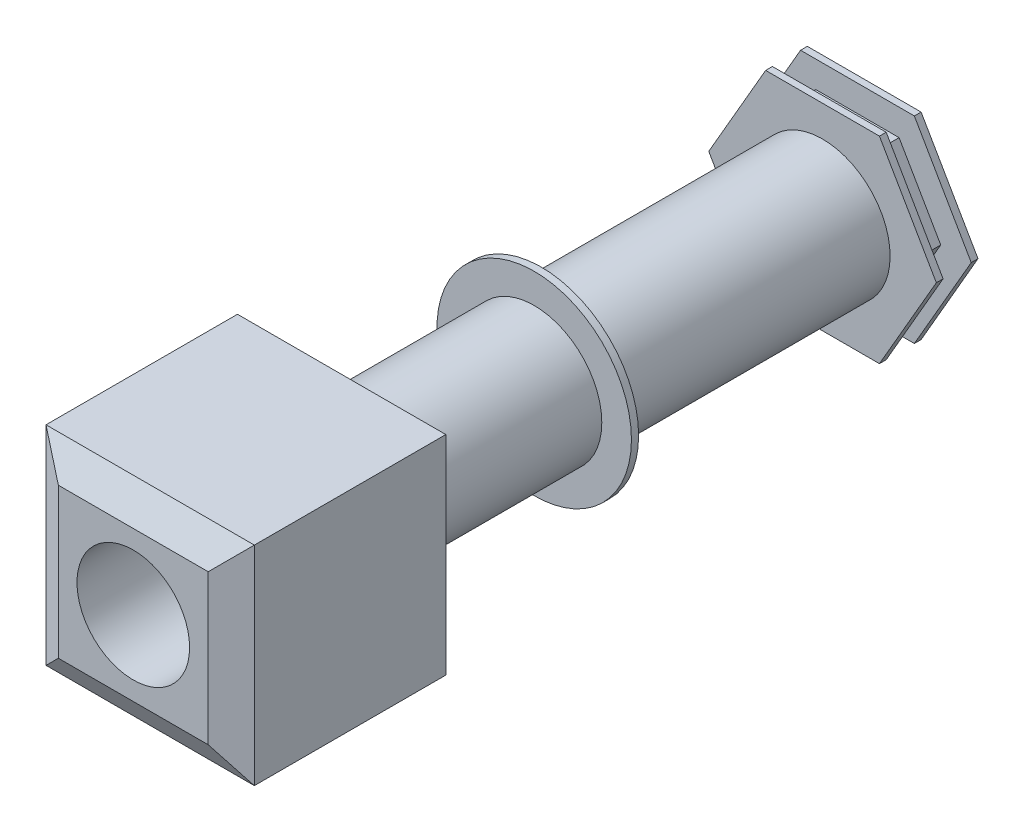
from build123d import *
from OCP.BRepFilletAPI import BRepFilletAPI_MakeChamfer

# Parameters (mm, degrees)
BOSS_EXTRUDE1_DEPTH = 12
BOSS_EXTRUDE2_DEPTH = 50
BOSS_EXTRUDE3_DEPTH = 12
SKETCH4_R           = 120
BOSS_EXTRUDE4_DEPTH = 500
SKETCH5_R           = 172.646944325
BOSS_EXTRUDE5_DEPTH = 12
CHAMFER1_SIZE       = 56.712818196
CHAMFER1_SIZE_2     = 10
SKETCH6_R           = 120
BOSS_EXTRUDE6_DEPTH = 330
SKETCH8_R           = 172.646944325
BOSS_EXTRUDE7_DEPTH = 12
CHAMFER2_SIZE       = 6
CHAMFER2_SIZE2      = 16.484864517
SKETCH9_W           = 370
SKETCH9_H           = 370
BOSS_EXTRUDE8_DEPTH = 370
SKETCH10_R          = 100
CUT_EXTRUDE1_DEPTH  = 900
CHAMFER3_SIZE       = 30
CHAMFER3_SIZE2      = 51.961524227


with BuildPart() as part:
    # Sketch1 → Boss-Extrude1 (new body)
    with BuildSketch(Plane.XY):
        Polygon((202.072594216, 0), (101.036297108, 175), (-101.036297108, 175), (-202.072594216, 0), (-101.036297108, -175), (101.036297108, -175), align=None)
    extrude(amount=BOSS_EXTRUDE1_DEPTH)

    # Sketch2 → Boss-Extrude2 (add)
    with BuildSketch(Plane.XY.offset(12)):
        Polygon((147.887498821, 0), (73.943749411, 128.074330881), (-73.943749411, 128.074330881), (-147.887498821, 0), (-73.943749411, -128.074330881), (73.943749411, -128.074330881), align=None)
    extrude(amount=BOSS_EXTRUDE2_DEPTH)

    # Sketch3 → Boss-Extrude3 (add)
    with BuildSketch(Plane.XY.offset(62)):
        Polygon((202.072594216, 0), (101.036297108, 175), (-101.036297108, 175), (-202.072594216, 0), (-101.036297108, -175), (101.036297108, -175), align=None)
    extrude(amount=BOSS_EXTRUDE3_DEPTH)

    # Sketch4 → Boss-Extrude4 (add)
    with BuildSketch(Plane.XY.offset(74)):
        Circle(SKETCH4_R)
    extrude(amount=BOSS_EXTRUDE4_DEPTH)

    # Sketch5 → Boss-Extrude5 (add)
    with BuildSketch(Plane.XY.offset(574)):
        Circle(SKETCH5_R)
    extrude(amount=BOSS_EXTRUDE5_DEPTH)

    # Chamfer1
    # the kernel refuses this chamfer: 56.712818196, 10 mm, written as the material it adds along each edge
    with BuildSketch(Plane(origin=(0, 0, 574), x_dir=(1, 0, 0), z_dir=(0, -1, 0))) as chamfer1_piece_1_section:
        Polygon((120 + CHAMFER1_SIZE, 0), (120, -CHAMFER1_SIZE_2), (120, 0), align=None)
    chamfer1_piece_1 = revolve(axis=Axis((0, 0, 574), (0, 0, 1)), mode=Mode.PRIVATE)
    chamfer1_piece_1 = chamfer1_piece_1 & Plane(origin=(0, 0, 569.114385433), x_dir=(1, 0, 0), z_dir=(0, 0, -1)) * Cylinder(172.646944325, 707, mode=Mode.PRIVATE)
    add(chamfer1_piece_1)

    # Sketch6 → Boss-Extrude6 (add)
    with BuildSketch(Plane.XY.offset(586)):
        Circle(SKETCH6_R)
    extrude(amount=BOSS_EXTRUDE6_DEPTH)

    # Sketch8 → Boss-Extrude7 (add)
    with BuildSketch(Plane.XY.offset(916)):
        Circle(SKETCH8_R)
    extrude(amount=BOSS_EXTRUDE7_DEPTH)

    # Chamfer2
    chamfer2_edges = [part.edges().sort_by_distance(p)[0] for p in [
        (-120, 0, 916),
    ]]
    chamfer2_side = [part.faces().sort_by_distance(p)[0] for p in [
        (-120, 0, 751),
    ]]
    chamfer(chamfer2_edges, length=CHAMFER2_SIZE, length2=CHAMFER2_SIZE2, reference=chamfer2_side[0])

    # Sketch9 → Boss-Extrude8 (add)
    with BuildSketch(Plane.XY.offset(928)):
        Rectangle(SKETCH9_W, SKETCH9_H)
    extrude(amount=BOSS_EXTRUDE8_DEPTH)

    # Sketch10 → Cut-Extrude1 (cut)
    with BuildSketch(Plane.XY.offset(1298)):
        Circle(SKETCH10_R)
    extrude(amount=-CUT_EXTRUDE1_DEPTH, mode=Mode.SUBTRACT)

    # Chamfer3: one chamfer whose edges measure the first distance from different faces: ONE call of the kernel's chamfer builder (chamfer() names one face for all edges)
    chamfer3_edges_1 = [part.edges().sort_by_distance(p)[0] for p in [
        (185, 0, 1298),
    ]]
    chamfer3_side_1 = [part.faces().sort_by_distance(p)[0] for p in [
        (185, 0, 1113),
    ]]
    chamfer3_edges_2 = [part.edges().sort_by_distance(p)[0] for p in [
        (0, 185, 1298),
    ]]
    chamfer3_side_2 = [part.faces().sort_by_distance(p)[0] for p in [
        (0, 185, 1113),
    ]]
    chamfer3_edges_3 = [part.edges().sort_by_distance(p)[0] for p in [
        (-185, 0, 1298),
    ]]
    chamfer3_side_3 = [part.faces().sort_by_distance(p)[0] for p in [
        (-185, 0, 1113),
    ]]
    chamfer3_edges_4 = [part.edges().sort_by_distance(p)[0] for p in [
        (0, -185, 1298),
    ]]
    chamfer3_side_4 = [part.faces().sort_by_distance(p)[0] for p in [
        (0, -185, 1113),
    ]]
    chamfer3 = BRepFilletAPI_MakeChamfer(part.part.solid().wrapped)
    for e in chamfer3_edges_1:
        chamfer3.Add(CHAMFER3_SIZE, CHAMFER3_SIZE2, e.wrapped, chamfer3_side_1[0].wrapped)  # the first distance lies on this face
    for e in chamfer3_edges_2:
        chamfer3.Add(CHAMFER3_SIZE, CHAMFER3_SIZE2, e.wrapped, chamfer3_side_2[0].wrapped)  # the first distance lies on this face
    for e in chamfer3_edges_3:
        chamfer3.Add(CHAMFER3_SIZE, CHAMFER3_SIZE2, e.wrapped, chamfer3_side_3[0].wrapped)  # the first distance lies on this face
    for e in chamfer3_edges_4:
        chamfer3.Add(CHAMFER3_SIZE, CHAMFER3_SIZE2, e.wrapped, chamfer3_side_4[0].wrapped)  # the first distance lies on this face
    add(Compound.cast(chamfer3.Shape()), mode=Mode.REPLACE)


solid = part.part
